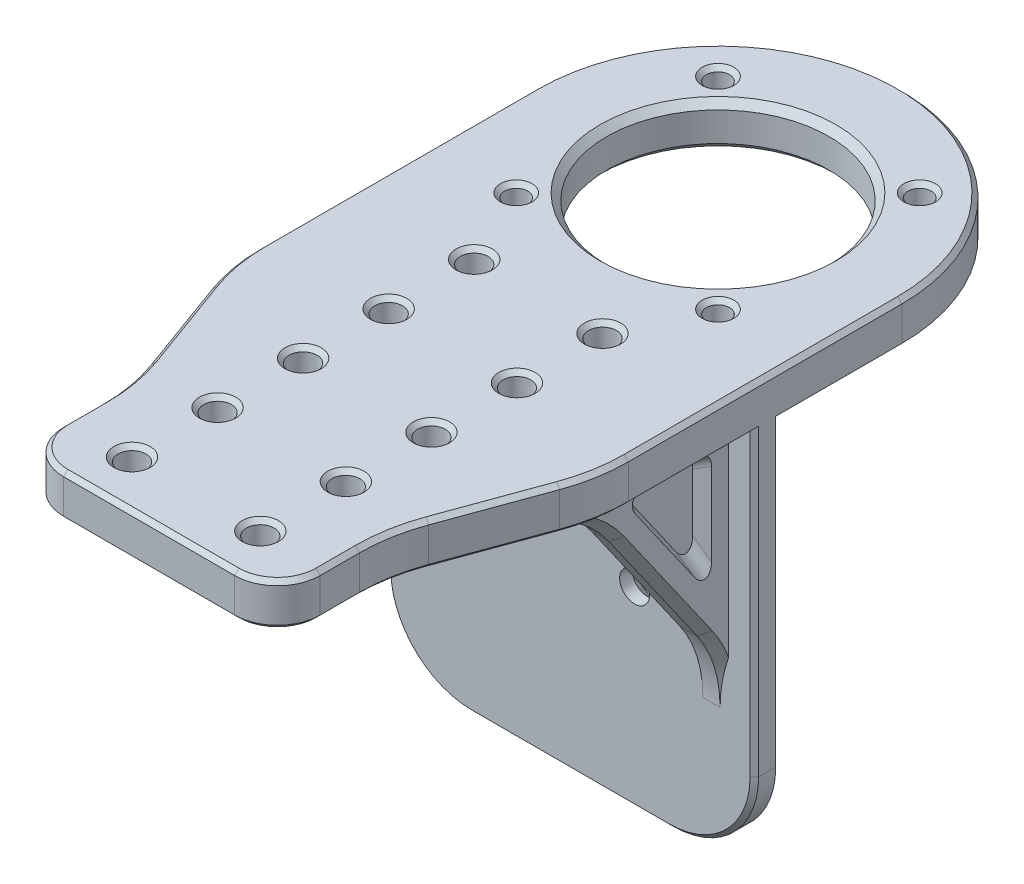
from build123d import *

# Parameters (mm, degrees)
SKETCH_1_R              = 26.000000000000004
SKETCH_1_R_2            = 2.700000000000001
SKETCH_1_R_3            = 2.7000000000000015
SKETCH_1_R_4            = 2.700000000000003
EXTRUDE_1_DEPTH         = 10
FILLET_1_RADIUS         = 43
FILLET_1_LENGTH         = 10
SKETCH_2_W              = 86
SKETCH_2_H              = 10
EXTRUDE_2_DEPTH         = 90
EXTRUDE_3_DEPTH         = 90
FILLET_2_R              = 20
EXTRUDE_START           = -6
EXTRUDE_4_DEPTH         = 6
FILLET_3_R              = 30
FILLET_3_OF_MIRROR_1_R  = 30
CHAMFER_1_SIZE          = 2
CHAMFER_2_SIZE          = 1.6
CUT_EXTRUDE_1_DEPTH     = 37.00000000000001
FILLET_4_R              = 40
FILLET_5_R              = 10
CHAMFER_3_SIZE          = 1
SKETCH_6_R              = 3.4999999999999996
SKETCH_6_R_2            = 3.5000000000000018
SKETCH_6_R_3            = 3.5000000000000027
SKETCH_6_R_4            = 3.500000000000001
CUT_EXTRUDE_2_DEPTH     = 37.00000000000001
CHAMFER_4_SIZE          = 3
SKETCH_7_R              = 3.2500000000000027
SKETCH_7_R_2            = 3.2500000000000013
SKETCH_7_R_3            = 3.2499999999999996
SKETCH_7_R_4            = 3.249999999999999
SKETCH_7_R_5            = 3.2500000000000044
CUT_EXTRUDE_3_DEPTH     = 20
CHAMFER_5_SIZE          = 1
CUT_EXTRUDE_4_DEPTH     = 3
CUT_EXTRUDE_4_DRAFT     = -25.000000000000053
FILLET_6_R              = 4
FILLET_7_R              = 2.4
FILLET_8_R              = 3
MIRROR_2_COPY_1_DEPTH   = 3
MIRROR_2_COPY_1_DRAFT   = -25.000000000000053
FILLET_6_OF_MIRROR_2_R  = 4
FILLET_7_OF_MIRROR_2_R  = 2.4
FILLET_8_OF_MIRROR_2_R  = 3
SKETCH_9_W              = 3.600000000000005
SKETCH_9_H              = 16
EXTRUDE_5_DEPTH         = 6
EXTRUDE_6_DEPTH         = 3.6
CUT_EXTRUDE_5_DEPTH     = 6
FILLET_START            = 28
FILLET_9_DEPTH          = 6
FILLET_START_2          = 29.1
FILLET_9_2_DEPTH        = 3.6
FILLET_10_R             = 2
CUT_EXTRUDE_6_DEPTH     = 30
FILLET_10_OF_MIRROR_3_R = 2


with BuildPart() as part:
    # 草图1 → 凸台-拉伸1 (new body)
    with BuildSketch(Plane(origin=(0, 0, 0), x_dir=(1, 0, 0), z_dir=(0, 1, 0))):
        Polygon((-43.00000000000001, 42.999999999999986), (42.999999999999986, 42.999999999999986), (43, -43.00000000000001), (-43, -43.00000000000001), align=None)
        with Locations(Location((0, 0, 0), (0, 0, 270))):
            Circle(SKETCH_1_R, mode=Mode.SUBTRACT)
        with Locations(Location((-23.582011152571376, 23.58201115257135, 0), (0, 0, 270))):
            Circle(SKETCH_1_R_2, mode=Mode.SUBTRACT)
        with Locations(Location((23.58201115257144, 23.582011152571294, 0), (0, 0, 270))):
            Circle(SKETCH_1_R_3, mode=Mode.SUBTRACT)
        with Locations(Location((23.582011152571205, -23.582011152571507, 0), (0, 0, 270))):
            Circle(SKETCH_1_R_4, mode=Mode.SUBTRACT)
        with Locations(Location((-23.5820111525716, -23.58201115257113, 0), (0, 0, 270))):
            Circle(SKETCH_1_R_4, mode=Mode.SUBTRACT)
    extrude(amount=EXTRUDE_1_DEPTH)

    # 圆角1: full round fillet: the end face becomes a half cylinder, R = half its width
    fillet_1_face = Plane((0, 5, -43), x_dir=(0, 1, 0), z_dir=(0, 0, -1))  # on the end face: x along it, z out of the body
    fillet_1_slab = fillet_1_face.offset(-FILLET_1_RADIUS / 2) * Box(FILLET_1_LENGTH, 2 * FILLET_1_RADIUS, FILLET_1_RADIUS, mode=Mode.PRIVATE)  # the body's end, R deep
    fillet_1_round = Plane((0, 5, 0), x_dir=(0, 0, -1), z_dir=(0, 1, 0)) * Cylinder(FILLET_1_RADIUS, FILLET_1_LENGTH, mode=Mode.PRIVATE)  # its axis R under the face
    add(fillet_1_slab - fillet_1_round, mode=Mode.SUBTRACT)

    # 草图2 → 凸台-拉伸2 (add)
    with BuildSketch(Plane.XY.offset(43.00000000000001)):
        with Locations((0, 5)):
            Rectangle(SKETCH_2_W, SKETCH_2_H)
    extrude(amount=EXTRUDE_2_DEPTH)

    # 草图3 → 凸台-拉伸3 (add)
    with BuildSketch(Plane.XZ):
        Polygon((43, 34.49999999999883), (-43, 34.49999999999881), (-43, 28.49999999999882), (43, 28.49999999999883), align=None)
    extrude(amount=EXTRUDE_3_DEPTH)

    # 圆角2
    fillet_2_edges = [part.edges().sort_by_distance(p)[0] for p in [
        (43, -90, 31.499999999998828),
        (-43, -90, 31.499999999998817),
    ]]
    fillet(fillet_2_edges, radius=FILLET_2_R)

    # 草图4 → 凸台-拉伸4 (add)
    with BuildSketch(Plane.ZY.offset(43).offset(EXTRUDE_START)):
        Polygon((34.499999999998806, -50), (34.499999999998806, 0), (69.4999999999988, 0), align=None)
    extrude_4 = extrude(amount=-EXTRUDE_4_DEPTH)

    # 圆角3
    fillet_3_edges = [part.edges().sort_by_distance(p)[0] for p in [
        (-33.999999999999986, 0, 69.4999999999988),
        (-33.99999999999999, -50, 34.49999999999881),
    ]]
    fillet(fillet_3_edges, radius=FILLET_3_R)

    # 镜向1: 凸台-拉伸4 across plane
    add(extrude_4.mirror(Plane.ZY))

    # 圆角3 of 镜向1
    fillet_3_of_mirror_1_edges = [part.edges().sort_by_distance(p)[0] for p in [
        (34.00000000000001, 0, 69.49999999999879),
        (34.00000000000001, -50, 34.4999999999988),
    ]]
    fillet(fillet_3_of_mirror_1_edges, radius=FILLET_3_OF_MIRROR_1_R)

    # 倒角1
    # the kernel refuses this chamfer: 2 mm, written as the material it takes off along each edge
    with BuildSketch(Plane(origin=(-36.999999999999986, -29.999999999999996, 85.11966684719991), x_dir=(0, 0.8705813126730031, 0.4920245705496333), z_dir=(0, -0.4920245705496333, 0.8705813126730031))) as chamfer_1_piece_1_section:
        Polygon((30.000000000000004, -CHAMFER_1_SIZE), (29.999999999999996 + CHAMFER_1_SIZE, -7.11e-15), (29.999999999999996, -7.11e-15), align=None)
    chamfer_1_piece_1 = revolve(axis=Axis((-36.999999999999986, -29.999999999999996, 85.11966684719991), (-1, 0, 1.6e-16)), revolution_arc=84.4817176024173, mode=Mode.PRIVATE)
    chamfer_1_piece_1 = split(chamfer_1_piece_1, bisect_by=Plane(origin=(-36.999999999999986, 0, 85.11966684719991), z_dir=(0, -1, 0)), keep=Keep.TOP, mode=Mode.PRIVATE)
    add(chamfer_1_piece_1, mode=Mode.SUBTRACT)
    with BuildSketch(Plane(origin=(-36.99999999999999, -59.45666692457301, 64.4999999999988), x_dir=(0, -0.49198457156885594, -0.870603917598703), z_dir=(0, -0.870603917598703, 0.49198457156885594))) as chamfer_1_piece_2_section:
        Polygon((30, CHAMFER_1_SIZE), (30 + CHAMFER_1_SIZE, 7.58e-15), (30, 0), align=None)
    chamfer_1_piece_2 = revolve(axis=Axis((-36.99999999999999, -59.45666692457301, 64.4999999999988), (1, 0, -1.6e-16)), revolution_arc=64.46312557106798, mode=Mode.PRIVATE)
    chamfer_1_piece_2 = split(chamfer_1_piece_2, bisect_by=Plane(origin=(-36.999999999999986, -59.45666692457301, 34.49999999999881), z_dir=(-1.7e-16, 0, 1)), keep=Keep.TOP, mode=Mode.PRIVATE)
    add(chamfer_1_piece_2, mode=Mode.SUBTRACT)
    with BuildSketch(Plane(origin=(37.000000000000014, -12.796129669100145, 60.5427092316287), x_dir=(-1, 1.24e-15, -1.62e-15), z_dir=(0, -0.8192319205190405, -0.5734623443633283))) as chamfer_1_piece_3:
        Polygon((CHAMFER_1_SIZE, 0), (4.07e-15, CHAMFER_1_SIZE), (0, 0), align=None)
    extrude(amount=35.956444306894355, mode=Mode.SUBTRACT)
    with BuildSketch(Plane(origin=(37.00000000000002, -29.999999999999996, 85.11966684719991), x_dir=(0, 0.8705813126730014, 0.492024570549636), z_dir=(0, -0.492024570549636, 0.8705813126730014))) as chamfer_1_piece_4_section:
        Polygon((29.999999999999996, CHAMFER_1_SIZE), (29.999999999999996 + CHAMFER_1_SIZE, -7.11e-15), (29.999999999999996, -7.11e-15), align=None)
    chamfer_1_piece_4 = revolve(axis=Axis((37.00000000000002, -29.999999999999996, 85.11966684719991), (-1, 0, 1.6e-16)), revolution_arc=84.48171760241743, mode=Mode.PRIVATE)
    chamfer_1_piece_4 = split(chamfer_1_piece_4, bisect_by=Plane(origin=(37.00000000000002, 0, 85.11966684719991), z_dir=(0, -1, 0)), keep=Keep.TOP, mode=Mode.PRIVATE)
    add(chamfer_1_piece_4, mode=Mode.SUBTRACT)
    with BuildSketch(Plane(origin=(37.000000000000014, -59.45666692457297, 64.49999999999882), x_dir=(0, -0.4919845715688563, -0.8706039175987028), z_dir=(0, -0.8706039175987028, 0.4919845715688563))) as chamfer_1_piece_5_section:
        Polygon((29.999999999999996, -CHAMFER_1_SIZE), (29.999999999999996 + CHAMFER_1_SIZE, 7.58e-15), (29.999999999999996, 0), align=None)
    chamfer_1_piece_5 = revolve(axis=Axis((37.000000000000014, -59.45666692457297, 64.49999999999882), (1, 0, -1.6e-16)), revolution_arc=64.463125571068, mode=Mode.PRIVATE)
    chamfer_1_piece_5 = split(chamfer_1_piece_5, bisect_by=Plane(origin=(37.00000000000002, -59.45666692457297, 34.49999999999883), z_dir=(-1.7e-16, 0, 1)), keep=Keep.TOP, mode=Mode.PRIVATE)
    add(chamfer_1_piece_5, mode=Mode.SUBTRACT)
    with BuildSketch(Plane(origin=(-36.99999999999999, -12.796129669100152, 60.542709231628706), x_dir=(1, 1.59e-15, -2.44e-15), z_dir=(0, -0.8192319205190405, -0.5734623443633283))) as chamfer_1_piece_6:
        Polygon((CHAMFER_1_SIZE, 0), (5.82e-15, -CHAMFER_1_SIZE), (0, 0), align=None)
    extrude(amount=35.956444306894376, mode=Mode.SUBTRACT)

    # 倒角2
    chamfer_2_edges = [part.edges().sort_by_distance(p)[0] for p in [
        (7.96e-15, 0, -26.000000000000004),
        (7.96e-15, 10, -26.000000000000004),
    ]]
    chamfer(chamfer_2_edges, length=CHAMFER_2_SIZE)

    # 草图5 → 切除-拉伸1 (cut)
    with BuildSketch(Plane.XZ):
        Polygon((43, 71.00000000000001), (30.000000000171415, 106.71720645243899), (30.000000000171415, 133), (43, 133), align=None)
        Polygon((-42.999999999999986, 71), (-43, 133), (-30.000000000171415, 133), (-30.000000000171408, 106.71720645243897), align=None)
    extrude(amount=-CUT_EXTRUDE_1_DEPTH, mode=Mode.SUBTRACT)

    # 圆角4
    fillet_4_edges = [part.edges().sort_by_distance(p)[0] for p in [
        (43, 5, 71.00000000000001),
        (30.000000000171415, 5, 106.71720645243899),
        (-30.000000000171408, 5, 106.71720645243897),
        (-42.999999999999986, 5, 71),
    ]]
    fillet(fillet_4_edges, radius=FILLET_4_R)

    # 圆角5
    fillet_5_edges = [part.edges().sort_by_distance(p)[0] for p in [
        (30.000000000171415, 5, 133),
        (-30.000000000171415, 5, 133),
    ]]
    fillet(fillet_5_edges, radius=FILLET_5_R)

    # 倒角3
    chamfer_3_edges = [part.edges().sort_by_distance(p)[0] for p in [
        (43, 10, 31.973460385830663),
        (43, 0, 49.223460385830066),
        (-30.00000000017141, 0, 118.3851428403888),
        (-36.500000000085706, 0, 88.85860322621947),
        (36.50000000008572, 0, 88.85860322621947),
        (-42.39231012048831, 0, 70.89284787833857),
        (42.39231012048832, 0, 70.89284787833856),
        (36.50000000008572, 10, 88.85860322621947),
        (-36.50000000008571, 10, 88.85860322621946),
        (30.000000000171415, 10, 118.38514284038881),
        (-42.39231012048831, 10, 70.89284787833857),
        (42.39231012048832, 10, 70.89284787833856),
        (30.607689879683107, 0, 106.82435857410036),
        (30.607689879683107, 10, 106.82435857410036),
        (-30.607689879683093, 0, 106.82435857410037),
        (-30.607689879683093, 10, 106.82435857410034),
        (0, 10, 133),
        (0, 0, 133),
        (30.000000000171415, 0, 118.3851428403888),
        (27.071067812036894, 0, 130.07106781186548),
        (-27.071067812036887, 0, 130.07106781186548),
        (-30.00000000017141, 10, 118.3851428403888),
        (27.071067812036894, 10, 130.07106781186548),
        (-27.071067812036887, 10, 130.07106781186548),
        (-43, 0, 14.249999999999403),
        (-43, 10, 31.973460385830666),
        (-2.63e-15, 10, -43),
        (2.63e-15, 0, -43),
        (-43, 0, 49.223460385830066),
        (43, 0, 14.249999999999417),
        (0, -90, 34.49999999999882),
        (0, -90, 28.499999999998828),
        (-43, -35, 34.49999999999881),
        (43, -35, 34.49999999999883),
        (-37.14213562373095, -84.14213562373095, 34.49999999999881),
        (37.14213562373096, -84.14213562373095, 34.49999999999882),
        (43, -35, 28.49999999999883),
        (-43, -35, 28.49999999999882),
        (-37.14213562373095, -84.14213562373095, 28.499999999998828),
        (37.14213562373096, -84.14213562373095, 28.49999999999883),
    ]]
    chamfer(chamfer_3_edges, length=CHAMFER_3_SIZE)

    # 草图6 → 切除-拉伸2 (cut)
    with BuildSketch(Plane.XY.offset(34.49999999999882)):
        with Locations((-15.000000000023746, -14.999999999974305)):
            Circle(SKETCH_6_R)
        with Locations((14.99999999998716, -14.99999999998674)):
            Circle(SKETCH_6_R_2)
        with Locations((14.99999999998716, -44.99999999996167)):
            Circle(SKETCH_6_R_3)
        with Locations((-15.000000000023746, -44.99999999997411)):
            Circle(SKETCH_6_R_4)
    extrude(amount=-CUT_EXTRUDE_2_DEPTH, mode=Mode.SUBTRACT)

    # 倒角4
    chamfer_4_edges = [part.edges().sort_by_distance(p)[0] for p in [
        (-18.500000000023753, -44.99999999997411, 28.499999999998828),
        (11.499999999987153, -44.99999999996167, 28.499999999998828),
        (11.499999999987153, -14.99999999998674, 28.499999999998828),
        (-18.50000000002375, -14.999999999974305, 28.499999999998828),
    ]]
    chamfer(chamfer_4_edges, length=CHAMFER_4_SIZE)

    # 草图7 → 切除-拉伸3 (cut)
    with BuildSketch(Plane(origin=(0, 10, 0), x_dir=(1, 3e-16, 0), z_dir=(-3e-16, 1, -1.16e-15))):
        with Locations(Location((14.999999999972957, -122.00000000000001, 0), (0, 0, 270))):
            Circle(SKETCH_7_R)
        with Locations(Location((14.999999999972887, -102.00000000000001, 0), (0, 0, 270))):
            Circle(SKETCH_7_R)
        with Locations(Location((14.99999999997282, -82.00000000000001, 0), (0, 0, 270))):
            Circle(SKETCH_7_R_2)
        with Locations(Location((14.99999999997275, -62.00000000000002, 0), (0, 0, 270))):
            Circle(SKETCH_7_R_2)
        with Locations(Location((14.999999999972683, -42.00000000000002, 0), (0, 0, 270))):
            Circle(SKETCH_7_R)
        with Locations(Location((-14.999999999972953, -122.00000000000003, 0), (0, 0, 270))):
            Circle(SKETCH_7_R_3)
        with Locations(Location((-14.999999999972887, -102.00000000000001, 0), (0, 0, 270))):
            Circle(SKETCH_7_R_4)
        with Locations(Location((-14.999999999972824, -82.00000000000004, 0), (0, 0, 270))):
            Circle(SKETCH_7_R_5)
        with Locations(Location((-14.999999999972758, -62.00000000000008, 0), (0, 0, 270))):
            Circle(SKETCH_7_R_2)
        with Locations(Location((-14.999999999972697, -42.00000000000008, 0), (0, 0, 270))):
            Circle(SKETCH_7_R)
    extrude(amount=-CUT_EXTRUDE_3_DEPTH, mode=Mode.SUBTRACT)

    # 倒角5
    chamfer_5_edges = [part.edges().sort_by_distance(p)[0] for p in [
        (-23.582011152571376, 0, -26.28201115257135),
        (-23.582011152571376, 10, -26.28201115257135),
        (23.58201115257144, 0, -26.282011152571297),
        (23.58201115257144, 10, -26.282011152571297),
        (23.582011152571205, 0, 20.882011152571504),
        (23.582011152571205, 10, 20.882011152571504),
        (-23.5820111525716, 0, 20.882011152571128),
        (-23.5820111525716, 10, 20.882011152571128),
        (14.999999999972893, -3.78e-15, 98.75000000000003),
        (14.99999999997289, 10.000000000000119, 98.75000000000001),
        (14.999999999972825, -3.78e-15, 78.75000000000003),
        (14.999999999972822, 10.000000000000096, 78.75000000000001),
        (14.999999999972756, -3.78e-15, 58.750000000000036),
        (14.999999999972752, 10.000000000000073, 58.75000000000002),
        (14.999999999972689, -3.78e-15, 38.750000000000036),
        (14.999999999972685, 10.00000000000005, 38.75000000000002),
        (-14.999999999972948, -3.78e-15, 118.75000000000004),
        (-14.999999999972951, 10.000000000000133, 118.75000000000003),
        (-14.999999999972882, -3.78e-15, 98.75000000000003),
        (-14.999999999972886, 10.00000000000011, 98.75000000000001),
        (-14.999999999972818, -3.78e-15, 78.75000000000006),
        (-14.999999999972822, 10.000000000000087, 78.75000000000004),
        (-14.999999999972752, -3.78e-15, 58.75000000000009),
        (-14.999999999972756, 10.000000000000064, 58.75000000000008),
        (-14.999999999972692, -3.78e-15, 38.75000000000009),
        (-14.999999999972696, 10.00000000000004, 38.75000000000008),
        (14.999999999972962, -3.78e-15, 118.75000000000003),
        (14.999999999972959, 10.000000000000142, 118.75000000000001),
    ]]
    chamfer(chamfer_5_edges, length=CHAMFER_5_SIZE)


with BuildPart() as cut_extrude_4_tool:
    # 草图8 → 切除-拉伸4 (with draft: the straight prism first)
    with BuildSketch(Plane.ZY.offset(37.00000000000001)):
        Polygon((55.627317708514475, -9.355355602920183), (59.376066630558604, -3.999999999999999), (38.49999999999881, -4), (38.49999999999881, -33.82295232937112), align=None)
    extrude(amount=-CUT_EXTRUDE_4_DEPTH)
    # 切除-拉伸4: the draft: its side faces are tilted about the plane it starts from
    cut_extrude_4_sides = [cut_extrude_4_tool.faces().sort_by_distance(p)[0] for p in [
        (-35.5, -18.911476165, 48.938033315),
        (-35.5, -18.911476165, 38.5),
        (-35.5, -4, 48.938033315),
    ]]
    draft(cut_extrude_4_sides, Plane.ZY.offset(37.00000000000001), CUT_EXTRUDE_4_DRAFT)


with BuildPart() as part_1:
    add(part.part)

    # 切除-拉伸4: cut by cut_extrude_4_tool
    add(cut_extrude_4_tool.part, mode=Mode.SUBTRACT)

    # 圆角6
    fillet_6_edges = [part_1.edges().sort_by_distance(p)[0] for p in [
        (-35.5, -4.6994614872325, 39.19946148723131),
    ]]
    fillet(fillet_6_edges, radius=FILLET_6_R)

    # 圆角7
    fillet_7_edges = [part_1.edges().sort_by_distance(p)[0] for p in [
        (-35.5, -31.60400512690079, 39.19946148723132),
    ]]
    fillet(fillet_7_edges, radius=FILLET_7_R)

    # 圆角8
    fillet_8_edges = [part_1.edges().sort_by_distance(p)[0] for p in [
        (-35.49999999999999, -4.699461487232503, 58.032642034999114),
    ]]
    fillet(fillet_8_edges, radius=FILLET_8_R)


with BuildPart() as mirror_2_copy_1_tool:
    # 镜向2 copy 1 sketch → 镜向2 copy 1 (with draft: the straight prism first)
    with BuildSketch(Plane(origin=(37.00000000000001, 0, 7.34e-15), x_dir=(-2e-16, 0, 1), z_dir=(1, 0, 2e-16))):
        Polygon((55.627317708514475, 9.355355602920183), (59.376066630558604, 3.999999999999999), (38.49999999999881, 4), (38.49999999999881, 33.82295232937112), align=None)
    extrude(amount=-MIRROR_2_COPY_1_DEPTH)
    # 镜向2 copy 1: the draft: its side faces are tilted about the plane it starts from
    mirror_2_copy_1_sides = [mirror_2_copy_1_tool.faces().sort_by_distance(p)[0] for p in [
        (35.5, -18.911476165, 48.938033315),
        (35.5, -18.911476165, 38.5),
        (35.5, -4, 48.938033315),
    ]]
    draft(mirror_2_copy_1_sides, Plane(origin=(37.00000000000001, 0, 7.34e-15), x_dir=(-2e-16, 0, 1), z_dir=(1, 0, 2e-16)), MIRROR_2_COPY_1_DRAFT)


with BuildPart() as part_2:
    add(part_1.part)

    # 镜向2 copy 1: cut by mirror_2_copy_1_tool
    add(mirror_2_copy_1_tool.part, mode=Mode.SUBTRACT)

    # 圆角6 of 镜向2
    fillet_6_of_mirror_2_edges = [part_2.edges().sort_by_distance(p)[0] for p in [
        (35.5, -4.6994614872325, 39.19946148723131),
    ]]
    fillet(fillet_6_of_mirror_2_edges, radius=FILLET_6_OF_MIRROR_2_R)

    # 圆角7 of 镜向2
    fillet_7_of_mirror_2_edges = [part_2.edges().sort_by_distance(p)[0] for p in [
        (35.5, -31.60400512690079, 39.19946148723132),
    ]]
    fillet(fillet_7_of_mirror_2_edges, radius=FILLET_7_OF_MIRROR_2_R)

    # 圆角8 of 镜向2
    fillet_8_of_mirror_2_edges = [part_2.edges().sort_by_distance(p)[0] for p in [
        (35.49999999999999, -4.699461487232503, 58.032642034999114),
    ]]
    fillet(fillet_8_of_mirror_2_edges, radius=FILLET_8_OF_MIRROR_2_R)

    # 草图9 → 凸台-拉伸5 (add)
    with BuildSketch(Plane(origin=(-3.45e-15, 0, 28.499999999998824), x_dir=(-1, 0, -1.2e-16), z_dir=(1.2e-16, 0, -1))):
        with Locations((-30.89999999999847, -72.99999999999999)):
            Rectangle(SKETCH_9_W, SKETCH_9_H)
    extrude_5 = extrude(amount=EXTRUDE_5_DEPTH)

    # 草图12 → 凸台-拉伸6 (add)
    with BuildSketch(Plane(origin=(32.699999999998475, 0, 3.96e-15), x_dir=(1.2e-16, 0, -1), z_dir=(1, 0, 1.2e-16))):
        Polygon((-22.499999999998824, -80.99999999999999), (-28.499999999998824, -82.60769515458666), (-28.499999999998828, -80.99999999999999), align=None)
    extrude_6 = extrude(amount=-EXTRUDE_6_DEPTH)

    # 草图10 → 切除-拉伸5 (cut)
    with BuildSketch(Plane(origin=(32.699999999998475, 0, 3.96e-15), x_dir=(1.2e-16, 0, -1), z_dir=(1, 0, 1.2e-16))):
        Polygon((-28.499999999998828, -65.00000000000001), (-22.499999999998824, -70.99999999999984), (-22.499999999998824, -65.00000000000001), align=None)
    cut_extrude_5 = extrude(amount=-CUT_EXTRUDE_5_DEPTH, mode=Mode.SUBTRACT)

    # 圆角9: read off the stored shape, not the designer's step
    # 圆角9 outline → 圆角9 (cut)
    with BuildSketch(Plane.YZ.offset(FILLET_START)):
        with BuildLine():
            Line((-71, 22.5), (-69.828427125, 23.671572875))
            ThreePointArc((-69.828427125, 23.671572875), (-71.12612052, 22.80448187), (-72.656854249, 22.5))
            Line((-72.656854249, 22.5), (-71, 22.5))
        make_face()
    fillet_9 = extrude(amount=FILLET_9_DEPTH, mode=Mode.SUBTRACT)

    # Fillet 9 2 outline → Fillet 9 2 (add)
    with BuildSketch(Plane.YZ.offset(FILLET_START_2)):
        with BuildLine():
            Line((-65, 28.5), (-66.171572875, 27.328427125))
            ThreePointArc((-66.171572875, 27.328427125), (-64.87387948, 28.19551813), (-63.343145751, 28.5))
            Line((-63.343145751, 28.5), (-65, 28.5))
        make_face()
    fillet_9_2 = extrude(amount=FILLET_9_2_DEPTH)

    # 圆角10
    fillet_10_edges = [part_2.edges().sort_by_distance(p)[0] for p in [
        (30.899999999998467, -80.99999999999999, 22.499999999998828),
    ]]
    fillet(fillet_10_edges, radius=FILLET_10_R)

    # 草图11 → 切除-拉伸6 (cut)
    with BuildSketch(Plane.XZ.offset(90)):
        Polygon((32.699999999998475, 28.49999999999883), (31.08323014918386, 21.207222485464698), (34.6075346676326, 21.207222485464698), align=None)
    cut_extrude_6 = extrude(amount=-CUT_EXTRUDE_6_DEPTH, mode=Mode.SUBTRACT)

    # 镜向3: 凸台-拉伸5, 凸台-拉伸6, 切除-拉伸5, 圆角9, Fillet 9 2, 切除-拉伸6 across plane
    add(extrude_5.mirror(Plane(origin=(0, 0, 0), x_dir=(0, 0, 1), z_dir=(1, 0, 0))))
    add(extrude_6.mirror(Plane(origin=(0, 0, 0), x_dir=(0, 0, 1), z_dir=(1, 0, 0))))
    add(cut_extrude_5.mirror(Plane(origin=(0, 0, 0), x_dir=(0, 0, 1), z_dir=(1, 0, 0))), mode=Mode.SUBTRACT)
    add(fillet_9.mirror(Plane(origin=(0, 0, 0), x_dir=(0, 0, 1), z_dir=(1, 0, 0))), mode=Mode.SUBTRACT)
    add(fillet_9_2.mirror(Plane(origin=(0, 0, 0), x_dir=(0, 0, 1), z_dir=(1, 0, 0))))
    add(cut_extrude_6.mirror(Plane(origin=(0, 0, 0), x_dir=(0, 0, 1), z_dir=(1, 0, 0))), mode=Mode.SUBTRACT)

    # 圆角10 of 镜向3
    fillet_10_of_mirror_3_edges = [part_2.edges().sort_by_distance(p)[0] for p in [
        (-30.899999999998467, -80.99999999999999, 22.499999999998828),
    ]]
    fillet(fillet_10_of_mirror_3_edges, radius=FILLET_10_OF_MIRROR_3_R)


solid = part_2.part
